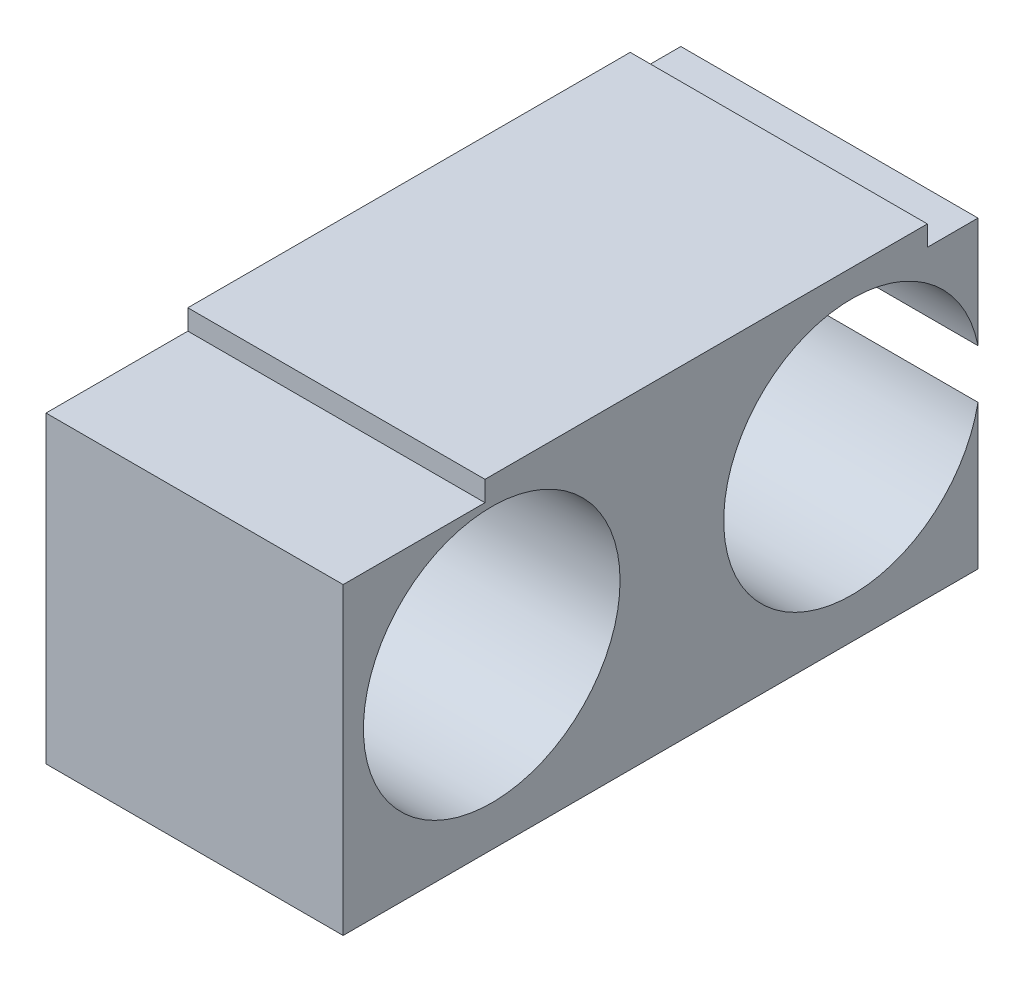
from build123d import *

# Parameters (mm, degrees)
SKETCH1_W           = 44
SKETCH1_H           = 94
BOSS_EXTRUDE1_DEPTH = 48
SKETCH2_R           = 19
CUT_EXTRUDE1_DEPTH  = 81.305666052
SKETCH3_W           = 7.5
SKETCH3_H           = 3
SKETCH3_W_2         = 21
CUT_EXTRUDE2_DEPTH  = 81.305666052


with BuildPart() as part:
    # Sketch1 → Boss-Extrude1 (new body)
    with BuildSketch(Plane(origin=(0, 0, 0), x_dir=(1, 0, 0), z_dir=(0, 1, 0))):
        Rectangle(SKETCH1_W, SKETCH1_H)
    extrude(amount=BOSS_EXTRUDE1_DEPTH)

    # Sketch2 → Cut-Extrude1 (cut, through all)
    with BuildSketch(Plane(origin=(22, 0, 0), x_dir=(0, 0, -1), z_dir=(1, 0, 0))):
        with Locations((-25, 25)):
            Circle(SKETCH2_R)
        with Locations((28.35, 25)):
            Circle(SKETCH2_R)
    extrude(amount=-CUT_EXTRUDE1_DEPTH, mode=Mode.SUBTRACT)

    # Sketch3 → Cut-Extrude2 (cut, through all)
    with BuildSketch(Plane(origin=(22, 0, 0), x_dir=(0, 0, -1), z_dir=(1, 0, 0))):
        with Locations((43.25, 46.5)):
            Rectangle(SKETCH3_W, SKETCH3_H)
        with Locations((-36.5, 46.5)):
            Rectangle(SKETCH3_W_2, SKETCH3_H)
    extrude(amount=-CUT_EXTRUDE2_DEPTH, mode=Mode.SUBTRACT)


solid = part.part
